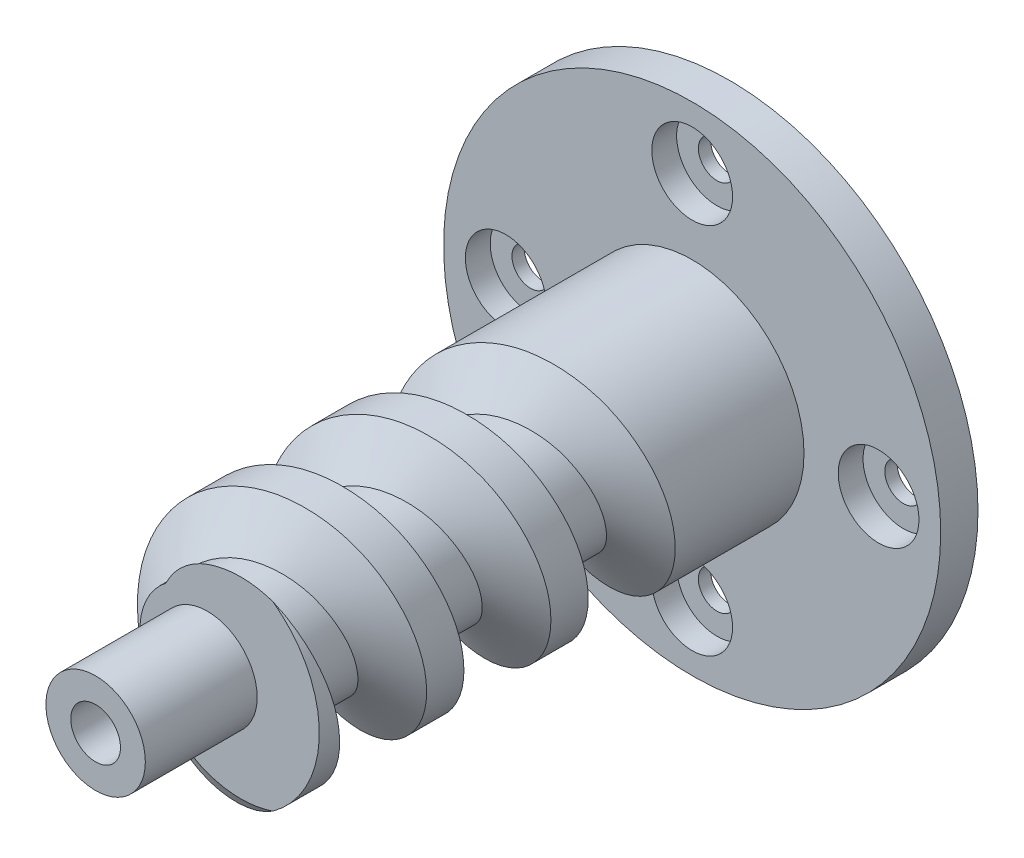
from build123d import *

# Parameters (mm, degrees)
SKETCH1_R                                        = 20
EXTRUDE1_DEPTH                                   = 3
SKETCH2_R                                        = 9
EXTRUDE2_DEPTH                                   = 6
SKETCH3_R                                        = 9
EXTRUDE3_DEPTH                                   = 33
CUT_SWEEP1_PITCH                                 = 10
SKETCH6_R                                        = 4
EXTRUDE4_DEPTH                                   = 9
CBORE_FOR_M3_PAN_HEAD_MACHINE_SCREW1_D           = 3
CBORE_FOR_M3_PAN_HEAD_MACHINE_SCREW1_CBORE_D     = 6.5
CBORE_FOR_M3_PAN_HEAD_MACHINE_SCREW1_CBORE_DEPTH = 2
SKETCH8_R                                        = 2
EXTRUDE5_DEPTH                                   = 59.318093247
SKETCH9_R                                        = 3.25
EXTRUDE6_DEPTH                                   = 3


with BuildPart() as part:
    # Sketch1 → Extrude1 (new body)
    with BuildSketch(Plane.XY):
        Circle(SKETCH1_R)
    extrude(amount=EXTRUDE1_DEPTH)

    # Sketch2 → Extrude2 (add)
    with BuildSketch(Plane.XY.offset(3)):
        Circle(SKETCH2_R)
    extrude(amount=EXTRUDE2_DEPTH)

    # Sketch3 → Extrude3 (add)
    with BuildSketch(Plane.XY.offset(9)):
        Circle(SKETCH3_R)
    extrude(amount=EXTRUDE3_DEPTH)

    # Cut-Sweep1: arcs per turn and ends read off the stored shape
    # Cut-Sweep1: the profile of Sketch5 screwed along a right-hand helix through 4 turns, 8 arcs to a turn; built about Z, then put on its axis
    cut_sweep1_z = Axis((0, 0, 0), (0, 0, 1))
    cut_sweep1_corners = [(5.437822174, 0, -8.556624327), (5.437822174, 0, -11.443375673), (12.031088913, 0, -15.25), (12.031088913, 0, -4.75)]
    with BuildLine(mode=Mode.PRIVATE) as cut_sweep1_profile:
        Line(cut_sweep1_corners[0], cut_sweep1_corners[1])
        Line(cut_sweep1_corners[1], cut_sweep1_corners[2])
        Line(cut_sweep1_corners[2], cut_sweep1_corners[3])
        Line(cut_sweep1_corners[3], cut_sweep1_corners[0])
    cut_sweep1_cap = Face(cut_sweep1_profile.wire())
    cut_sweep1_turn_angles = [0, 22.5, 45, 67.5, 90, 112.5, 135, 157.5, 180, 202.5, 225, 247.5, 270, 292.5, 315, 337.5, 360]
    cut_sweep1_turn_weights = [1, 0.9238795325112867, 1, 0.9238795325112867, 1, 0.9238795325112867, 1, 0.9238795325112867, 1, 0.9238795325112867, 1, 0.9238795325112867, 1, 0.9238795325112867, 1, 0.9238795325112867, 1]
    cut_sweep1_turn_rails = [Edge.make_bspline([Vector(p[0], p[1], 0).rotate(cut_sweep1_z, cut_sweep1_turn_angles[k]) / cut_sweep1_turn_weights[k] + Vector(0, 0, p[2] + CUT_SWEEP1_PITCH * cut_sweep1_turn_angles[k] / 360) for k in range(17)], [0, 0, 0, 1, 1, 2, 2, 3, 3, 4, 4, 5, 5, 6, 6, 7, 7, 8, 8, 8], 2, cut_sweep1_turn_weights) for p in cut_sweep1_corners]
    cut_sweep1_turn_sides = [Face.make_surface_from_curves(cut_sweep1_turn_rails[p[0]], cut_sweep1_turn_rails[p[1]]) for p in [(0, 1), (1, 2), (2, 3), (3, 0)]]
    cut_sweep1 = Plane(origin=(0, 0, 42), x_dir=(-1, 0, 0), z_dir=(0, 0, -1)) * Solid(Shell([*[p.moved(Location((0, 0, CUT_SWEEP1_PITCH * i))) for i in range(4) for p in cut_sweep1_turn_sides], cut_sweep1_cap, cut_sweep1_cap.rotate(cut_sweep1_z, 1440).moved(Location((0, 0, CUT_SWEEP1_PITCH * 1440 / 360)))]))
    add(cut_sweep1, mode=Mode.SUBTRACT)

    # Sketch6 → Extrude4 (add)
    with BuildSketch(Plane.XY.offset(42)):
        Circle(SKETCH6_R)
    extrude(amount=EXTRUDE4_DEPTH)

    # CBORE for M3 Pan Head Machine Screw1 (through all)
    with Locations(Plane(origin=(15, 0, 3), x_dir=(1, 0, 0), z_dir=(0, 0, 1))):
        with Locations((0, 0), (-15, -15), (-30, 0), (-15, 15)):
            CounterBoreHole(CBORE_FOR_M3_PAN_HEAD_MACHINE_SCREW1_D / 2, CBORE_FOR_M3_PAN_HEAD_MACHINE_SCREW1_CBORE_D / 2, CBORE_FOR_M3_PAN_HEAD_MACHINE_SCREW1_CBORE_DEPTH)

    # Sketch8 → Extrude5 (cut, through all)
    with BuildSketch(Plane(origin=(0, 0, 0), x_dir=(-1, 0, 0), z_dir=(0, 0, -1))):
        Circle(SKETCH8_R)
    extrude(amount=-EXTRUDE5_DEPTH, mode=Mode.SUBTRACT)

    # Sketch9 → Extrude6 (cut)
    with BuildSketch(Plane(origin=(0, 0, 0), x_dir=(-1, 0, 0), z_dir=(0, 0, -1))):
        Circle(SKETCH9_R)
    extrude(amount=-EXTRUDE6_DEPTH, mode=Mode.SUBTRACT)


solid = part.part
